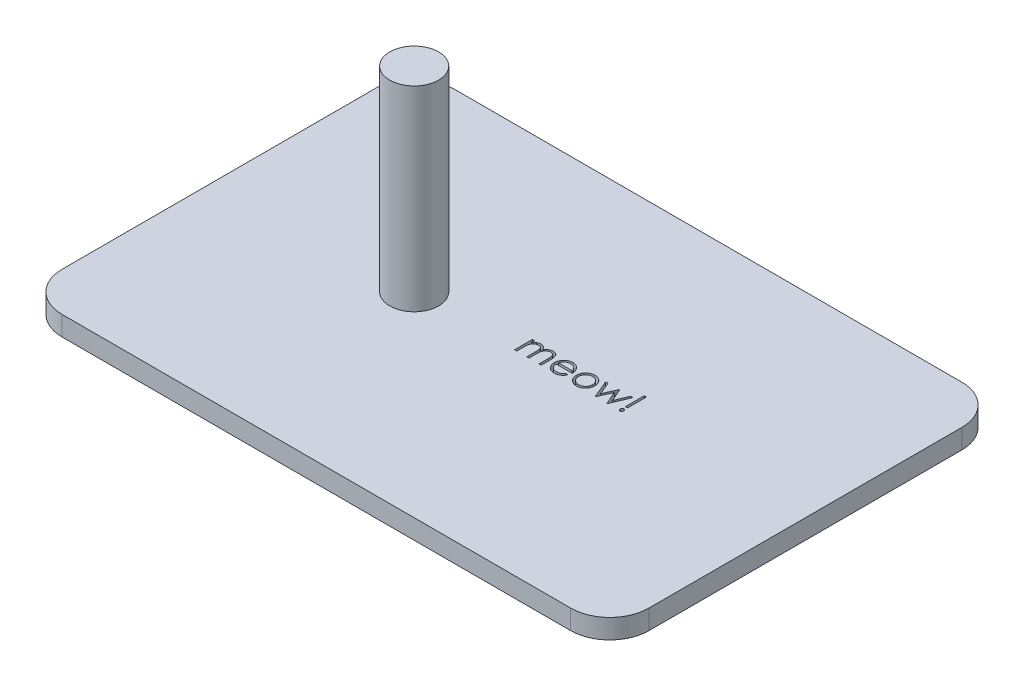
from build123d import *

# Parameters (mm, degrees)
SKETCH2_W           = 76.2
SKETCH2_H           = 50.8
BOSS_EXTRUDE1_DEPTH = 2.54
FILLET1_R           = 5.08
SKETCH3_R           = 3.175
BOSS_EXTRUDE2_DEPTH = 25.4
SKETCH5_W           = 0.284935898
SKETCH5_H           = 2.442307692
CUT_EXTRUDE1_DEPTH  = 53.363441445


with BuildPart() as part:
    # Sketch2 → Boss-Extrude1 (new body)
    with BuildSketch(Plane(origin=(0, 0, 0), x_dir=(1, 0, 0), z_dir=(0, 1, 0))):
        Rectangle(SKETCH2_W, SKETCH2_H)
    extrude(amount=BOSS_EXTRUDE1_DEPTH)

    # Fillet1
    fillet1_edges = [part.edges().sort_by_distance(p)[0] for p in [
        (38.1, 1.27, -25.4),
        (38.1, 1.27, 25.4),
        (-38.1, 1.27, -25.4),
        (-38.1, 1.27, 25.4),
    ]]
    fillet(fillet1_edges, radius=FILLET1_R)

    # Sketch3 → Boss-Extrude2 (add)
    with BuildSketch(Plane(origin=(0, 2.54, 0), x_dir=(1, 0, 0), z_dir=(0, 1, 0))):
        with Locations((-12.7, 0)):
            Circle(SKETCH3_R)
    extrude(amount=BOSS_EXTRUDE2_DEPTH)

    # Sketch5 → Cut-Extrude1 (cut, through all)
    # profile 1 of 6: a face of its own
    with BuildSketch(Plane(origin=(0, 2.54, 0), x_dir=(1, 0, 0), z_dir=(0, 1, 0))):
        with BuildLine():
            Line((0.325641026, 2.320192308), (0.610576923, 2.320192308))
            Line((0.610576923, 2.320192308), (0.610576923, 1.916957131))
            add(Edge.make_bspline(
                [(0.610576923, 1.916957131), (0.636234506, 1.952233742), (0.685396895, 2.019827109), (0.766010737, 2.108899724), (0.846543354, 2.184490264), (0.904540064, 2.224171297), (0.932401843, 2.243234175)],
                knots=[0, 0, 0, 0, 1.134379233, 2.173579362, 3.122582517, 4, 4, 4, 4], degree=3))
            add(Edge.make_bspline(
                [(0.932401843, 2.243234175), (0.970379072, 2.261381899), (1.045670024, 2.297360285), (1.164886035, 2.333857871), (1.286873771, 2.35628707), (1.369249794, 2.359354459), (1.410687099, 2.360897436)],
                knots=[0, 0, 0, 0, 1.014936303, 2.012140481, 3.000054389, 4, 4, 4, 4], degree=3))
            add(Edge.make_bspline(
                [(1.410687099, 2.360897436), (1.438711461, 2.359949208), (1.494170164, 2.358072715), (1.576342875, 2.345862541), (1.656043187, 2.324756798), (1.732800199, 2.295358726), (1.805118244, 2.259756374), (1.871420588, 2.21798271), (1.930951119, 2.171086078), (1.983679752, 2.11694876), (2.031095225, 2.05405056), (2.074709607, 1.980695134), (2.115009621, 1.895235327), (2.137344665, 1.833217108), (2.149103566, 1.800565905)],
                knots=[0, 0, 0, 0, 1.009824226, 1.998387844, 2.986035974, 3.974953746, 4.955485308, 5.885931332, 6.793869504, 7.679848016, 8.601185859, 9.625726857, 10.749998409, 12, 12, 12, 12], degree=3))
            add(Edge.make_bspline(
                [(2.149103566, 1.800565905), (2.161541629, 1.822994486), (2.186017992, 1.867130782), (2.227116677, 1.929595063), (2.27017675, 1.988021224), (2.315565183, 2.042455623), (2.363121772, 2.09262945), (2.413070328, 2.13870859), (2.465126523, 2.180890926), (2.537509483, 2.230169792), (2.631682348, 2.282513007), (2.750416567, 2.327895953), (2.873924222, 2.355941298), (2.957760277, 2.359234474), (3.000095152, 2.360897436)],
                knots=[0, 0, 0, 0, 0.86119277, 1.694706429, 2.50939023, 3.298075842, 4.073795165, 4.829715201, 5.57930267, 6.321991688, 7.768977793, 9.186738141, 10.579381044, 12, 12, 12, 12], degree=3))
            add(Edge.make_bspline(
                [(3.000095152, 2.360897436), (3.038994765, 2.359430386), (3.115125084, 2.356559226), (3.225957318, 2.334013575), (3.329318813, 2.295298852), (3.425001589, 2.242472625), (3.511325134, 2.176088651), (3.586360643, 2.097104777), (3.64965233, 2.006079683), (3.690998667, 1.920452665), (3.719043228, 1.844855613), (3.736334491, 1.780442763), (3.7516105, 1.70954814), (3.764293487, 1.632086974), (3.773563173, 1.547785637), (3.780430894, 1.456782085), (3.78507916, 1.359005591), (3.785407612, 1.291545459), (3.785576923, 1.256770833)],
                knots=[0, 0, 0, 0, 1.209669288, 2.367440248, 3.500751976, 4.631527125, 5.755587489, 6.87532382, 8.007944318, 9.190864318, 9.82315674, 10.514484317, 11.263564316, 12.079023757, 12.955305781, 13.901327259, 14.918167583, 16, 16, 16, 16], degree=3))
            Line((3.785576923, 1.256770833), (3.785576923, 0))
            Line((3.785576923, 0), (3.500641026, 0))
            Line((3.500641026, 0), (3.500641026, 1.258042869))
            add(Edge.make_bspline(
                [(3.500641026, 1.258042869), (3.500570375, 1.287725104), (3.500434594, 1.344769845), (3.497991086, 1.426641711), (3.493387051, 1.501270864), (3.488003486, 1.568555544), (3.480525173, 1.628652659), (3.470867792, 1.681441496), (3.460637325, 1.727337311), (3.443641105, 1.778215368), (3.416474089, 1.834340488), (3.375092517, 1.894868303), (3.322958921, 1.947555886), (3.262760779, 1.993292502), (3.194227547, 2.030479591), (3.118694548, 2.057037114), (3.03663073, 2.073477153), (2.979822915, 2.075115467), (2.950485777, 2.075961538)],
                knots=[0, 0, 0, 0, 1.253487763, 2.409012846, 3.458416907, 4.410876679, 5.259312806, 6.014470957, 6.676830364, 7.243083969, 8.276244668, 9.299465089, 10.325150304, 11.392391894, 12.482080715, 13.603491619, 14.762376348, 16, 16, 16, 16], degree=3))
            add(Edge.make_bspline(
                [(2.950485777, 2.075961538), (2.914499461, 2.074676881), (2.843376821, 2.072137911), (2.739558415, 2.046217326), (2.639798993, 2.007137384), (2.547075265, 1.950502227), (2.461778627, 1.882640354), (2.388391153, 1.801950363), (2.327764813, 1.710664644), (2.286712992, 1.626167278), (2.260778411, 1.55026714), (2.243654352, 1.483957381), (2.230334418, 1.40859053), (2.217842581, 1.324673021), (2.209689428, 1.231627214), (2.202279547, 1.129883522), (2.198813479, 1.01913593), (2.198328648, 0.942367434), (2.198076923, 0.902509014)],
                knots=[0, 0, 0, 0, 1.090531906, 2.155305635, 3.229839962, 4.33261226, 5.44038871, 6.529323825, 7.629011124, 8.757537029, 9.370236727, 10.061839251, 10.834451254, 11.692844982, 12.636905849, 13.66920014, 14.789842145, 16, 16, 16, 16], degree=3))
            Line((2.198076923, 0.902509014), (2.198076923, 0))
            Line((2.198076923, 0), (1.913141026, 0))
            Line((1.913141026, 0), (1.913141026, 1.1798127))
            add(Edge.make_bspline(
                [(1.913141026, 1.1798127), (1.91306897, 1.213098782), (1.912930343, 1.277137859), (1.910502541, 1.368971264), (1.905888249, 1.452501958), (1.900553751, 1.527632857), (1.892879161, 1.59422742), (1.884161734, 1.652642665), (1.873866923, 1.702732146), (1.856821813, 1.757671788), (1.830773688, 1.818197197), (1.788874336, 1.882732266), (1.736616031, 1.939218326), (1.675319594, 1.987440905), (1.606371582, 2.027302106), (1.53018664, 2.056022023), (1.447450755, 2.072735486), (1.390411693, 2.074865908), (1.361077724, 2.075961538)],
                knots=[0, 0, 0, 0, 1.320475261, 2.540461679, 3.643808994, 4.639130445, 5.527981419, 6.302341397, 6.981980563, 7.553956391, 8.582137848, 9.585246428, 10.591171744, 11.620968678, 12.668337649, 13.738356861, 14.836885341, 16, 16, 16, 16], degree=3))
            add(Edge.make_bspline(
                [(1.361077724, 2.075961538), (1.32659159, 2.074573193), (1.257861948, 2.071806269), (1.156895161, 2.04690132), (1.059390291, 2.007890481), (0.966902814, 1.953770502), (0.88192698, 1.886733481), (0.807533766, 1.807889254), (0.744993046, 1.718219059), (0.703507757, 1.634612676), (0.676748427, 1.560614063), (0.658972659, 1.497702846), (0.643696713, 1.427852621), (0.632344707, 1.350847884), (0.621386045, 1.267190177), (0.616097121, 1.176462747), (0.610952204, 1.078743425), (0.610705085, 1.011276902), (0.610576923, 0.976287059)],
                knots=[0, 0, 0, 0, 1.098833095, 2.189935336, 3.297829714, 4.440610912, 5.596351641, 6.740013378, 7.886572111, 9.072425424, 9.705826452, 10.395263256, 11.156850408, 11.985370555, 12.878090359, 13.847760091, 14.883794034, 16, 16, 16, 16], degree=3))
            Line((0.610576923, 0.976287059), (0.610576923, 0))
            Line((0.610576923, 0), (0.325641026, 0))
            Line((0.325641026, 0), (0.325641026, 2.320192308))
        make_face()
    # profile 2 of 6: a face of its own
    with BuildSketch(Plane(origin=(0, 2.54, 0), x_dir=(1, 0, 0), z_dir=(0, 1, 0))):
        with BuildLine():
            Line((6.341095753, 0.732692308), (6.594230769, 0.599764623))
            add(Edge.make_bspline(
                [(6.594230769, 0.599764623), (6.574059001, 0.563983887), (6.534812727, 0.494368744), (6.46732062, 0.398726985), (6.396570669, 0.312686557), (6.319369212, 0.238546085), (6.238026003, 0.1739109), (6.152089952, 0.117361587), (6.061113667, 0.069175501), (5.965092846, 0.028578565), (5.86322111, -0.002635762), (5.755251592, -0.024683162), (5.640977449, -0.038311413), (5.562649129, -0.039894505), (5.522541066, -0.040705128)],
                knots=[0, 0, 0, 0, 1.120438281, 2.179929193, 3.190490725, 4.156257408, 5.095198341, 6.022838206, 6.959905092, 7.901321166, 8.864066838, 9.862729781, 10.905609505, 12, 12, 12, 12], degree=3))
            add(Edge.make_bspline(
                [(5.522541066, -0.040705128), (5.477962272, -0.039664476), (5.391001959, -0.037634466), (5.264419475, -0.020133445), (5.145239574, 0.008416481), (5.033468957, 0.048299508), (4.929381342, 0.100394295), (4.832769852, 0.163857539), (4.743126425, 0.238363227), (4.663275893, 0.324556715), (4.591390371, 0.416796776), (4.527957662, 0.5129139), (4.474928421, 0.612666254), (4.431791411, 0.7154188), (4.396952712, 0.820523904), (4.372671488, 0.928937878), (4.358674502, 1.040367301), (4.356529612, 1.115748455), (4.355448718, 1.153735978)],
                knots=[0, 0, 0, 0, 1.145258523, 2.234067595, 3.276747158, 4.290159414, 5.277019952, 6.260822364, 7.254936242, 8.264827045, 9.274100331, 10.257902744, 11.220704747, 12.172965371, 13.118907548, 14.062713208, 15.023725156, 16, 16, 16, 16], degree=3))
            add(Edge.make_bspline(
                [(4.355448718, 1.153735978), (4.35640951, 1.189382002), (4.358313674, 1.260027716), (4.370315889, 1.364590031), (4.39158684, 1.466215842), (4.420775363, 1.564989591), (4.458468279, 1.660745898), (4.504580363, 1.753543042), (4.559183449, 1.843282276), (4.601340803, 1.899890833), (4.622576122, 1.928405449)],
                knots=[0, 0, 0, 0, 1.024358464, 2.0301432, 3.019427413, 4.004406732, 4.986367066, 5.972626655, 6.978780325, 8, 8, 8, 8], degree=3))
            add(Edge.make_bspline(
                [(4.622576122, 1.928405449), (4.65133952, 1.962757924), (4.707955164, 2.030374674), (4.803709858, 2.119218727), (4.907396465, 2.193644152), (5.017715583, 2.25533634), (5.135949384, 2.302211719), (5.260508527, 2.337143598), (5.392811308, 2.356717936), (5.483258187, 2.359482757), (5.52953726, 2.360897436)],
                knots=[0, 0, 0, 0, 1.030682036, 2.02871468, 2.997146059, 3.962720338, 4.930598197, 5.918074684, 6.934738563, 8, 8, 8, 8], degree=3))
            add(Edge.make_bspline(
                [(5.52953726, 2.360897436), (5.57711473, 2.35966912), (5.670450882, 2.357259445), (5.806551449, 2.334919842), (5.935330099, 2.299493596), (6.056735299, 2.249461229), (6.170779358, 2.18490935), (6.276720989, 2.104952108), (6.376372004, 2.012044272), (6.434346215, 1.940594789), (6.463847155, 1.904236779)],
                knots=[0, 0, 0, 0, 1.056321875, 2.072262726, 3.055038591, 4.01806755, 4.982017516, 5.957941055, 6.960871419, 8, 8, 8, 8], degree=3))
            add(Edge.make_bspline(
                [(6.463847155, 1.904236779), (6.483919449, 1.876837816), (6.52393043, 1.822222265), (6.574047443, 1.733167001), (6.617551651, 1.639993819), (6.652325123, 1.541196621), (6.680482384, 1.437946002), (6.700853927, 1.329503836), (6.712800653, 1.215902417), (6.715148971, 1.138499042), (6.716346154, 1.099038462)],
                knots=[0, 0, 0, 0, 0.94817472, 1.890038105, 2.849395472, 3.817997239, 4.812318967, 5.836947057, 6.897266129, 8, 8, 8, 8], degree=3))
            Line((6.716346154, 1.099038462), (4.640384615, 1.099038462))
            add(Edge.make_bspline(
                [(4.640384615, 1.099038462), (4.641781258, 1.068467326), (4.6445277, 1.008350421), (4.657332152, 0.920384068), (4.677514968, 0.836588251), (4.705880475, 0.757591491), (4.740231113, 0.682362018), (4.782309585, 0.611457885), (4.832510466, 0.545202048), (4.888504493, 0.483001859), (4.950831644, 0.427611026), (5.016402422, 0.378034057), (5.08615587, 0.336481837), (5.159541988, 0.302754366), (5.236442108, 0.276350779), (5.316880456, 0.258327828), (5.400698748, 0.246256381), (5.457835806, 0.244914113), (5.486924079, 0.244230769)],
                knots=[0, 0, 0, 0, 1.094153842, 2.151609401, 3.174256925, 4.172055639, 5.149267565, 6.128595816, 7.11444997, 8.118368179, 9.117203808, 10.09244225, 11.054858984, 12.015122123, 12.976791628, 13.957293641, 14.960065497, 16, 16, 16, 16], degree=3))
            add(Edge.make_bspline(
                [(5.486924079, 0.244230769), (5.515364048, 0.244782363), (5.571794403, 0.245876832), (5.655832895, 0.256519351), (5.738509467, 0.273728102), (5.81948193, 0.297214021), (5.897106912, 0.325858737), (5.968993947, 0.360423472), (6.035106714, 0.398659314), (6.096898533, 0.442392376), (6.156834363, 0.495921231), (6.216290761, 0.56271935), (6.280041725, 0.641720179), (6.31994657, 0.701179461), (6.341095753, 0.732692308)],
                knots=[0, 0, 0, 0, 0.99110716, 1.966546729, 2.947904876, 3.932708344, 4.903319531, 5.828989031, 6.710028674, 7.56322171, 8.463672341, 9.504779593, 10.677557249, 12, 12, 12, 12], degree=3))
        make_face()
        with BuildLine():
            add(Edge.make_bspline(
                [(6.431410256, 1.383974359), (6.420981176, 1.421768537), (6.400908552, 1.494510165), (6.358965564, 1.595240115), (6.311729238, 1.68476414), (6.255829525, 1.762397092), (6.192493966, 1.831343136), (6.119337265, 1.891594282), (6.03729899, 1.945494398), (5.946803198, 1.990989879), (5.850971008, 2.02971568), (5.750635391, 2.055682749), (5.648257254, 2.073471405), (5.579011152, 2.075127947), (5.544165665, 2.075961538)],
                knots=[0, 0, 0, 0, 1.154881502, 2.222775134, 3.210006277, 4.132804581, 5.035138423, 5.962687519, 6.919655026, 7.923214229, 8.944639381, 9.960483929, 10.97369054, 12, 12, 12, 12], degree=3))
            add(Edge.make_bspline(
                [(5.544165665, 2.075961538), (5.515727246, 2.075406665), (5.45951047, 2.074309797), (5.376687358, 2.063904751), (5.297149345, 2.046705463), (5.220309549, 2.023151538), (5.147174904, 1.991756592), (5.076241079, 1.954941807), (5.009311719, 1.910000514), (4.967454972, 1.875747838), (4.946309095, 1.85844351)],
                knots=[0, 0, 0, 0, 1.04873581, 2.073130211, 3.073294108, 4.04793562, 5.032784715, 6.005352987, 6.992311501, 8, 8, 8, 8], degree=3))
            add(Edge.make_bspline(
                [(4.946309095, 1.85844351), (4.931165903, 1.844750809), (4.900519774, 1.81704012), (4.859570873, 1.769297911), (4.820363729, 1.717816137), (4.784682487, 1.660625203), (4.751954962, 1.598376353), (4.72132984, 1.531594641), (4.693765024, 1.459773302), (4.678256409, 1.409724017), (4.670277444, 1.383974359)],
                knots=[0, 0, 0, 0, 0.879870761, 1.780643979, 2.707998968, 3.669668524, 4.684282772, 5.740141944, 6.837334558, 8, 8, 8, 8], degree=3))
            Line((4.670277444, 1.383974359), (6.431410256, 1.383974359))
        make_face(mode=Mode.SUBTRACT)
    # profile 3 of 6: a face of its own
    with BuildSketch(Plane(origin=(0, 2.54, 0), x_dir=(1, 0, 0), z_dir=(0, 1, 0))):
        with BuildLine():
            add(Edge.make_bspline(
                [(8.40688101, 2.360897436), (8.45041595, 2.359970435), (8.535777329, 2.358152812), (8.660788768, 2.338726379), (8.780118998, 2.309019841), (8.894225044, 2.267952067), (9.001645541, 2.212904869), (9.103945169, 2.147219298), (9.200843456, 2.069402231), (9.25892149, 2.009205983), (9.288401442, 1.978650841)],
                knots=[0, 0, 0, 0, 1.054011418, 2.066658804, 3.057071809, 4.030435133, 4.997543892, 5.974964718, 6.972108034, 8, 8, 8, 8], degree=3))
            add(Edge.make_bspline(
                [(9.288401442, 1.978650841), (9.313785072, 1.949428154), (9.364061088, 1.89154832), (9.428527848, 1.797699299), (9.484064549, 1.700507922), (9.528571663, 1.598683562), (9.563664506, 1.49311511), (9.588579816, 1.383439714), (9.60339975, 1.269899585), (9.605398156, 1.19278896), (9.606410256, 1.153735978)],
                knots=[0, 0, 0, 0, 1.025258237, 2.030674902, 3.01204498, 3.988269485, 4.97094183, 5.956517959, 6.965070386, 8, 8, 8, 8], degree=3))
            add(Edge.make_bspline(
                [(9.606410256, 1.153735978), (9.605520043, 1.11445664), (9.603760941, 1.036838836), (9.58712066, 0.922521268), (9.561238889, 0.811673108), (9.524198579, 0.704758435), (9.476702294, 0.601450442), (9.418744313, 0.502200351), (9.349917918, 0.406812344), (9.271900006, 0.316096391), (9.185674376, 0.232488468), (9.092133298, 0.159619252), (8.993114996, 0.097188297), (8.887302812, 0.046899549), (8.77566302, 0.007248606), (8.657954822, -0.020600694), (8.53436108, -0.037438793), (8.449972101, -0.039601034), (8.40688101, -0.040705128)],
                knots=[0, 0, 0, 0, 0.998656419, 1.973391657, 2.932242238, 3.890759089, 4.846373663, 5.82037756, 6.809684879, 7.83454468, 8.860553229, 9.859544525, 10.845671541, 11.83227036, 12.833544569, 13.85385346, 14.904124723, 16, 16, 16, 16], degree=3))
            add(Edge.make_bspline(
                [(8.40688101, -0.040705128), (8.3635788, -0.039597329), (8.278769234, -0.037427648), (8.154739236, -0.020666113), (8.036820082, 0.007235772), (7.925034139, 0.047029854), (7.818767028, 0.097189905), (7.719174991, 0.159430509), (7.625557925, 0.232510078), (7.539314054, 0.316090535), (7.461301033, 0.406813853), (7.392473375, 0.502199959), (7.334515722, 0.601450544), (7.287019352, 0.704758408), (7.249979064, 0.811673115), (7.224097287, 0.922521266), (7.207457008, 1.036838836), (7.205697906, 1.11445664), (7.204807692, 1.153735978)],
                knots=[0, 0, 0, 0, 1.099876186, 2.154163076, 3.173186993, 4.173200201, 5.163417411, 6.152872554, 7.150605724, 8.17532212, 9.198891216, 10.186952605, 11.159729845, 12.11414092, 13.071450619, 14.029093627, 15.002601286, 16, 16, 16, 16], degree=3))
            add(Edge.make_bspline(
                [(7.204807692, 1.153735978), (7.205826695, 1.192576701), (7.207844146, 1.269474659), (7.222649179, 1.38280135), (7.247467298, 1.492291124), (7.282602208, 1.597452092), (7.32751956, 1.698830237), (7.382275871, 1.796261763), (7.44740023, 1.88968641), (7.497476286, 1.94749144), (7.522816506, 1.976742788)],
                knots=[0, 0, 0, 0, 1.031353054, 2.041901799, 3.029428768, 4.008703097, 4.981709435, 5.96992636, 6.972712378, 8, 8, 8, 8], degree=3))
            add(Edge.make_bspline(
                [(7.522816506, 1.976742788), (7.552252014, 2.007562912), (7.610142119, 2.068176108), (7.707522751, 2.145766326), (7.809570717, 2.212818764), (7.918178328, 2.266772189), (8.032190635, 2.309261415), (8.152132377, 2.33880299), (8.277568023, 2.358082819), (8.363347108, 2.35994988), (8.40688101, 2.360897436)],
                knots=[0, 0, 0, 0, 1.027980169, 2.021703884, 2.998553061, 3.971491411, 4.943284454, 5.930300938, 6.949603206, 8, 8, 8, 8], degree=3))
        make_face()
        with BuildLine():
            add(Edge.make_bspline(
                [(8.405608974, 2.075961538), (8.374822713, 2.075086516), (8.314044932, 2.07335906), (8.22458288, 2.060220089), (8.138458597, 2.039403425), (8.055508689, 2.009826888), (7.976012882, 1.971637172), (7.899895067, 1.924730303), (7.826931354, 1.869727549), (7.758549054, 1.806714983), (7.695790813, 1.737881895), (7.640928649, 1.664540884), (7.594278731, 1.587881555), (7.555416587, 1.507824192), (7.526472209, 1.423557503), (7.505450967, 1.336035787), (7.492324392, 1.245080731), (7.490613177, 1.18324895), (7.48974359, 1.151827925)],
                knots=[0, 0, 0, 0, 1.021534396, 2.016698045, 2.994645724, 3.958388632, 4.93408049, 5.916473867, 6.921342795, 7.962252576, 8.998418191, 10.008913653, 10.997312074, 11.973003931, 12.956656626, 13.948281152, 14.957379055, 16, 16, 16, 16], degree=3))
            add(Edge.make_bspline(
                [(7.48974359, 1.151827925), (7.491201208, 1.111231443), (7.494094309, 1.030655018), (7.517621273, 0.911990642), (7.556978827, 0.798069962), (7.610125859, 0.689560812), (7.676715786, 0.589165246), (7.755171911, 0.499656113), (7.844652211, 0.422380413), (7.944090036, 0.358262789), (8.05145431, 0.307317867), (8.165079687, 0.271214511), (8.283589459, 0.24774519), (8.364579837, 0.245412495), (8.405608974, 0.244230769)],
                knots=[0, 0, 0, 0, 1.016792936, 2.018143844, 3.017858371, 4.030088057, 5.03801393, 6.028138512, 7.003788237, 7.991172063, 8.984598303, 9.972568034, 10.972917682, 12, 12, 12, 12], degree=3))
            add(Edge.make_bspline(
                [(8.405608974, 0.244230769), (8.446635752, 0.245419381), (8.527621471, 0.247765666), (8.645966582, 0.27109631), (8.759281399, 0.307476059), (8.866534158, 0.358205493), (8.965926719, 0.422623898), (9.056050565, 0.499219754), (9.133836805, 0.589402319), (9.200360861, 0.689693792), (9.254378263, 0.79790174), (9.293551596, 0.912011668), (9.317135121, 1.030649663), (9.320020587, 1.111229649), (9.321474359, 1.151827925)],
                knots=[0, 0, 0, 0, 1.02726834, 2.027799167, 3.010890988, 4.004497153, 4.992059811, 5.971914811, 6.958719428, 7.966827853, 8.981595046, 9.981490638, 10.983022906, 12, 12, 12, 12], degree=3))
            add(Edge.make_bspline(
                [(9.321474359, 1.151827925), (9.320605071, 1.183249138), (9.318894445, 1.245081288), (9.305763585, 1.336033657), (9.284758203, 1.423565319), (9.255755378, 1.507795351), (9.217062094, 1.588088837), (9.169512575, 1.664315804), (9.11487443, 1.738135956), (9.051358899, 1.806492473), (8.983047978, 1.869752114), (8.910054693, 1.924751631), (8.834049748, 1.971431021), (8.754784891, 2.01015354), (8.671824348, 2.039134341), (8.585820738, 2.060340285), (8.496740389, 2.073303535), (8.4361804, 2.075069871), (8.405608974, 2.075961538)],
                knots=[0, 0, 0, 0, 1.042956736, 2.052379634, 3.044323526, 4.02829302, 5.004299113, 5.996692471, 7.007513377, 8.048758398, 9.090003419, 10.095195979, 11.07790575, 12.047570684, 13.018257071, 13.989683339, 14.985167495, 16, 16, 16, 16], degree=3))
        make_face(mode=Mode.SUBTRACT)
    # profile 4 of 6: a face of its own
    with BuildSketch(Plane(origin=(0, 2.54, 0), x_dir=(1, 0, 0), z_dir=(0, 1, 0))):
        Polygon((9.850641026, 2.320192308), (10.156565505, 2.320192308), (10.847916667, 0.651282051), (11.605413662, 2.320192308), (11.653751002, 2.320192308), (12.394711538, 0.651282051), (13.092422877, 2.320192308), (13.391987179, 2.320192308), (12.422060296, 0), (12.362910657, 0), (11.621314103, 1.668910256), (10.864453125, 0), (10.811663662, 0), align=None)
    # profile 5 of 6: a face of its own
    with BuildSketch(Plane(origin=(0, 2.54, 0), x_dir=(1, 0, 0), z_dir=(0, 1, 0))):
        with Locations((14.063621795, 2.03525641)):
            Rectangle(SKETCH5_W, SKETCH5_H)
    # profile 6 of 6: a face of its own
    with BuildSketch(Plane(origin=(0, 2.54, 0), x_dir=(1, 0, 0), z_dir=(0, 1, 0))):
        with BuildLine():
            add(Edge.make_bspline(
                [(14.063621795, 0.488461538), (14.078569278, 0.487413648), (14.108075257, 0.485345138), (14.150757886, 0.47077439), (14.189477852, 0.445883687), (14.223400888, 0.41197961), (14.251874104, 0.371816592), (14.272376555, 0.326229442), (14.285850643, 0.276588415), (14.286939885, 0.241778374), (14.2875, 0.223878205)],
                knots=[0, 0, 0, 0, 0.932051743, 1.839848197, 2.779380411, 3.780329255, 4.815317283, 5.833513928, 6.885940208, 8, 8, 8, 8], degree=3))
            add(Edge.make_bspline(
                [(14.2875, 0.223878205), (14.286904548, 0.206407605), (14.285732939, 0.172032518), (14.272407237, 0.122778819), (14.251688337, 0.077127835), (14.223616146, 0.036486799), (14.189475612, 0.002462816), (14.150630253, -0.022208841), (14.108210244, -0.037774948), (14.078591298, -0.03972139), (14.063621795, -0.040705128)],
                knots=[0, 0, 0, 0, 1.089197406, 2.143100788, 3.162726492, 4.210031689, 5.212385385, 6.153236251, 7.066640104, 8, 8, 8, 8], degree=3))
            add(Edge.make_bspline(
                [(14.063621795, -0.040705128), (14.048652292, -0.03972139), (14.019033346, -0.037774948), (13.976613336, -0.022208841), (13.937767978, 0.002462816), (13.903627444, 0.036486799), (13.875555253, 0.077127835), (13.854836353, 0.122778819), (13.841510651, 0.172032518), (13.840339042, 0.206407605), (13.83974359, 0.223878205)],
                knots=[0, 0, 0, 0, 0.933359896, 1.846763749, 2.787614615, 3.789968311, 4.837273508, 5.856899212, 6.910802594, 8, 8, 8, 8], degree=3))
            add(Edge.make_bspline(
                [(13.83974359, 0.223878205), (13.840303704, 0.241778374), (13.841392946, 0.276588415), (13.854867035, 0.326229442), (13.875369486, 0.371816592), (13.903842701, 0.41197961), (13.937765738, 0.445883687), (13.976485703, 0.47077439), (14.019168333, 0.485345138), (14.048674312, 0.487413648), (14.063621795, 0.488461538)],
                knots=[0, 0, 0, 0, 1.114059792, 2.166486072, 3.184682717, 4.219670745, 5.220619589, 6.160151803, 7.067948257, 8, 8, 8, 8], degree=3))
        make_face()
    extrude(amount=-CUT_EXTRUDE1_DEPTH, mode=Mode.SUBTRACT)


with BuildPart() as cut_extrude1_piece_1:
    # of the separate pieces the step leaves, piece 1, a body of its own (cut_extrude1_pieces)
    add(part.part.solids().sort_by_distance((33.02, 0, -25.4))[0])


with BuildPart() as cut_extrude1_piece_2:
    # of the separate pieces the step leaves, piece 2, a body of its own (cut_extrude1_pieces)
    add(part.part.solids().sort_by_distance((7.48974359, 0, -1.151827925))[0])


with BuildPart() as cut_extrude1_piece_3:
    # of the separate pieces the step leaves, piece 3, a body of its own (cut_extrude1_pieces)
    add(part.part.solids().sort_by_distance((5.544165665, 0, -2.075961538))[0])


solid = Compound([cut_extrude1_piece_1.part, cut_extrude1_piece_2.part, cut_extrude1_piece_3.part])
